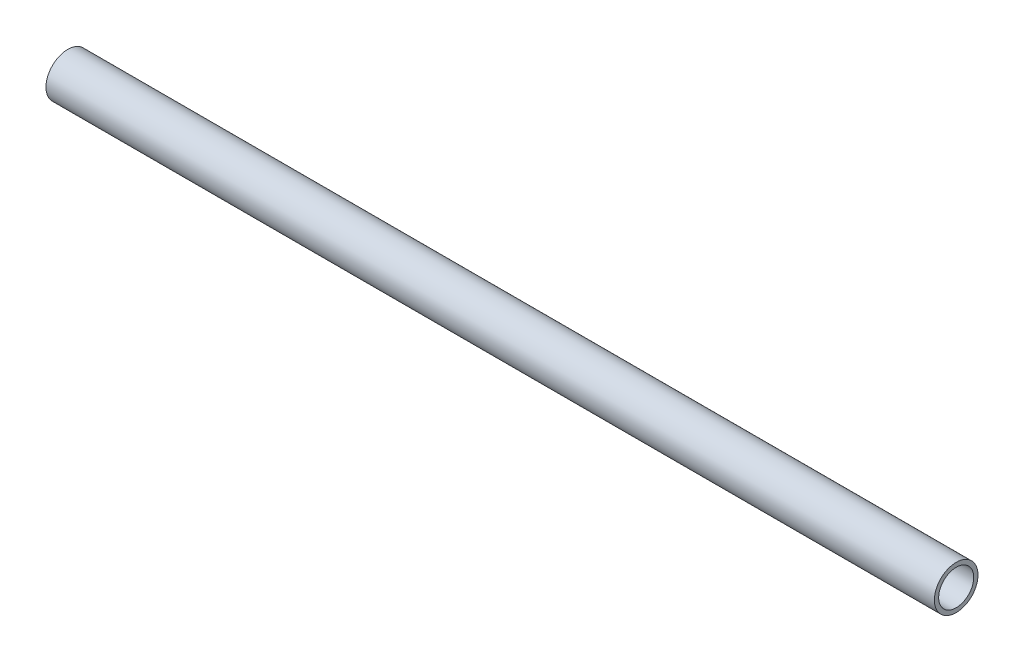
from build123d import *

# Parameters (mm, degrees)
SKIZZE1_R                       = 2.55
SKIZZE1_R_2                     = 2.05
AUFSATZ_LINEAR_AUSTRAGEN1_DEPTH = 51.95


with BuildPart() as part:
    # Skizze1 → Aufsatz-Linear austragen1 (new, symmetric)
    with BuildSketch(Plane(origin=(0, 0, 0), x_dir=(0, 0, -1), z_dir=(1, 0, 0))):
        Circle(SKIZZE1_R)
        Circle(SKIZZE1_R_2, mode=Mode.SUBTRACT)
    extrude(amount=AUFSATZ_LINEAR_AUSTRAGEN1_DEPTH, both=True)


solid = part.part
